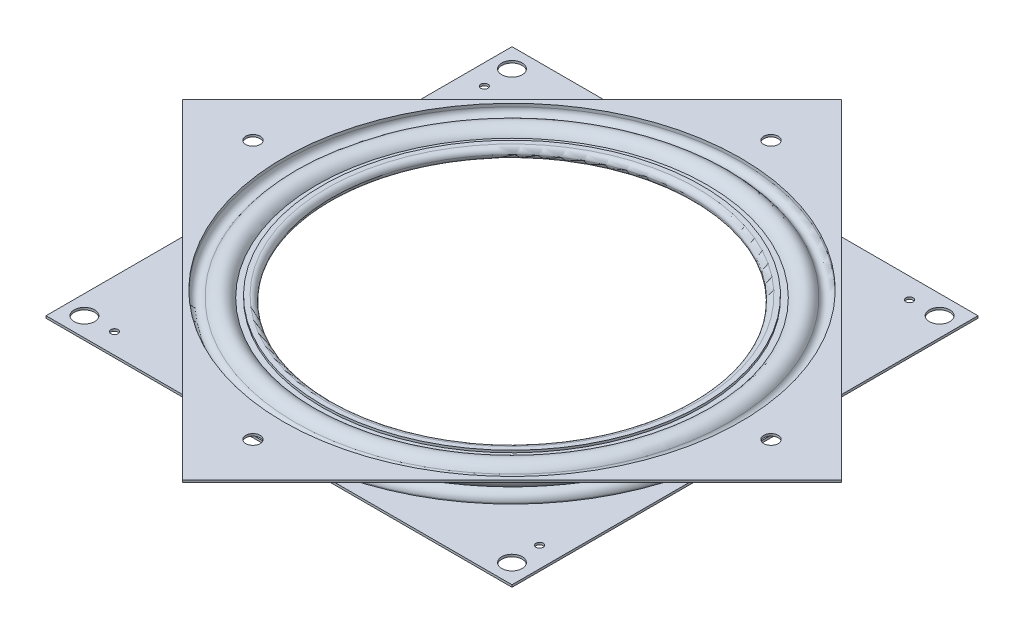
from build123d import *

# Parameters (mm, degrees)
SKETCH2_W                                 = 154.0002
SKETCH2_H                                 = 154.0002
SKETCH2_R                                 = 75.529340861
EXTRUDE1_DEPTH                            = 0.7366
EXTRUDE2_START                            = -0.7366
SKETCH3_R                                 = 75.529340861
EXTRUDE2_DEPTH                            = 0.7366
CIRPATTERN1_COUNT                         = 6
SKETCH5_W                                 = 3.3782
SKETCH5_H                                 = 0.7366
F_5_32_0_156250_DIAMETER_HOLE1_AT_2_COUNT = 2
F_5_32_0_156250_DIAMETER_HOLE1_AT_2_PITCH = 141.3002
F_5_32_0_156250_DIAMETER_HOLE1_AT_3_COUNT = 2
F_5_32_0_156250_DIAMETER_HOLE1_AT_3_PITCH = 141.3002
F_5_32_0_156250_DIAMETER_HOLE1_AT_4_COUNT = 2
F_5_32_0_156250_DIAMETER_HOLE1_AT_4_PITCH = 199.828659206
SKETCH7_W                                 = 2.3876
SKETCH7_H                                 = 8.128
F_5_32_0_156250_DIAMETER_HOLE2_AT_2_COUNT = 2
F_5_32_0_156250_DIAMETER_HOLE2_AT_2_PITCH = 121.0564
F_5_32_0_156250_DIAMETER_HOLE2_AT_3_COUNT = 2
F_5_32_0_156250_DIAMETER_HOLE2_AT_3_PITCH = 171.199602692
F_5_32_0_156250_DIAMETER_HOLE2_AT_4_COUNT = 2
F_5_32_0_156250_DIAMETER_HOLE2_AT_4_PITCH = 121.0564
CIRPATTERN2_COUNT                         = 4


# Read off the part's stored shape, not the designer's step: Revolve-Thin5
with BuildPart() as part:
    # Sketch1 → Revolve-Thin4 (revolve)
    with BuildSketch(Plane.XY, mode=Mode.PRIVATE) as revolve_thin4_sk:
        with BuildLine():
            Line((62.74854946, 1.778), (61.214, 1.778))
            ThreePointArc((61.214, 1.778), (59.436, 0), (61.214, -1.778))
            Line((61.214, -1.778), (64.28309892, -1.778))
            ThreePointArc((64.28309892, -1.778), (67.669225582, -4.788771381), (71.737577241, -2.794))
            ThreePointArc((71.737577241, -2.794), (74.023261161, -1.847238721), (75.529340861, -3.81))
            Line((75.529340861, -3.81), (75.529340861, -4.826))
            Line((75.529340861, -4.826), (77.0001, -4.826))
            Line((77.0001, -4.826), (77.0001, -4.0894))
            Line((77.0001, -4.0894), (76.265940861, -4.0894))
            Line((76.265940861, -4.0894), (76.265940861, -3.81))
            ThreePointArc((76.265940861, -3.81), (74.21390727, -1.135737757), (71.099662929, -2.4257))
            ThreePointArc((71.099662929, -2.4257), (67.492675346, -4.00937161), (64.902401285, -1.0414))
            Line((64.902401285, -1.0414), (61.214, -1.0414))
            ThreePointArc((61.214, -1.0414), (60.1726, 0), (61.214, 1.0414))
            Line((61.214, 1.0414), (62.74854946, 1.0414))
            Line((62.74854946, 1.0414), (62.74854946, 1.778))
        make_face()
    revolve(revolve_thin4_sk.sketch.rotate(Axis((0, 21.71272626, 0), (0, -1, 0)), 90), axis=Axis((0, 21.71272626, 0), (0, -1, 0)))

    # Sketch2 → Extrude1 (add)
    with BuildSketch(Plane.XZ.offset(4.826)):
        Rectangle(SKETCH2_W, SKETCH2_H)
        with Locations(Location((0, 0, 0), (0, 0, 90))):
            Circle(SKETCH2_R, mode=Mode.SUBTRACT)
    extrude(amount=-EXTRUDE1_DEPTH)

    # Sketch5 → 5/32 (0.156250) Diameter Hole1 (revolve, cut)
    with BuildSketch(Plane(origin=(70.6501, -4.0894, -70.6501), x_dir=(0, 0, 1), z_dir=(1, 0, 0))):
        with Locations((1.6891, 0.3683)):
            Rectangle(SKETCH5_W, SKETCH5_H)
    f_5_32_0_156250_diameter_hole1 = revolve(axis=Axis((70.6501, 2.2606, -70.6501), (0, -1, 0)), mode=Mode.SUBTRACT)

    # 5/32 (0.156250) Diameter Hole1 at 2: 5/32 (0.156250) Diameter Hole1 ×2
    with Locations(*[(0, 0, i * F_5_32_0_156250_DIAMETER_HOLE1_AT_2_PITCH) for i in range(1, F_5_32_0_156250_DIAMETER_HOLE1_AT_2_COUNT)]):
        add(f_5_32_0_156250_diameter_hole1, mode=Mode.SUBTRACT)

    # 5/32 (0.156250) Diameter Hole1 at 3: 5/32 (0.156250) Diameter Hole1 ×2
    with Locations(*[(-i * F_5_32_0_156250_DIAMETER_HOLE1_AT_3_PITCH, 0, 0) for i in range(1, F_5_32_0_156250_DIAMETER_HOLE1_AT_3_COUNT)]):
        add(f_5_32_0_156250_diameter_hole1, mode=Mode.SUBTRACT)

    # 5/32 (0.156250) Diameter Hole1 at 4: 5/32 (0.156250) Diameter Hole1 ×2
    with Locations(*[Vector(-0.7071067811865476, 0, 0.7071067811865476) * (i * F_5_32_0_156250_DIAMETER_HOLE1_AT_4_PITCH) for i in range(1, F_5_32_0_156250_DIAMETER_HOLE1_AT_4_COUNT)]):
        add(f_5_32_0_156250_diameter_hole1, mode=Mode.SUBTRACT)

    # Sketch11 → 3/32 (0.093750) Diameter Hole2 (revolve, cut)
    with BuildSketch(Plane(origin=(-70.2437, -4.0894, -61.1251), x_dir=(0, 0, 1), z_dir=(1, 0, 0))):
        Polygon((0, 0), (0, 26.115399675), (1.190625, 25.4), (1.190625, 0), align=None)
    f_3_32_0_093750_diameter_hole2 = revolve(axis=Axis((-70.2437, 2.2606, -61.1251), (0, -1, 0)), mode=Mode.SUBTRACT)

    # CirPattern2: 3/32 (0.093750) Diameter Hole2 ×4 about axis
    cirpattern2_axis = Axis((0, 0, 0), (0, 1, 0))
    for i in range(1, CIRPATTERN2_COUNT):
        add(f_3_32_0_093750_diameter_hole2.rotate(cirpattern2_axis, i * 360 / CIRPATTERN2_COUNT), mode=Mode.SUBTRACT)


with BuildPart() as body_2:
    # Revolve-Thin5 outline → Revolve-Thin5 (revolve)
    with BuildSketch(Plane.XY):
        with BuildLine():
            Line((77.0001, 3.302), (75.529340861, 3.302))
            Line((75.529340861, 3.302), (75.529340861, 2.286))
            ThreePointArc((75.529340861, 2.286), (74.023261161, 0.323238721), (71.737577241, 1.27))
            ThreePointArc((71.737577241, 1.27), (68.088390068, 3.299931105), (64.576093872, 1.0414))
            Line((64.576093872, 1.0414), (61.214, 1.0414))
            Line((61.214, 1.0414), (61.214, 0.3048))
            Line((61.214, 0.3048), (65.066299927, 0.3048))
            ThreePointArc((65.066299927, 0.3048), (67.890458911, 2.54923464), (71.099662929, 0.9017))
            ThreePointArc((71.099662929, 0.9017), (74.21390727, -0.388262243), (76.265940861, 2.286))
            Line((76.265940861, 2.286), (76.265940861, 2.5654))
            Line((76.265940861, 2.5654), (77.0001, 2.5654))
            Line((77.0001, 2.5654), (77.0001, 3.302))
        make_face()
    revolve(axis=Axis((0, 0, 0), (0, 1, 0)))

    # Sketch3 → Extrude2 (add)
    with BuildSketch(Plane(origin=(0, 3.302, 0), x_dir=(-1, 0, 0), z_dir=(0, 1, 0)).offset(EXTRUDE2_START)):
        Polygon((0, -108.894585724), (108.894585724, 0), (0, 108.894585724), (-108.894585724, 0), align=None)
        with Locations(Location((0, 0, 0), (0, 0, 90))):
            Circle(SKETCH3_R, mode=Mode.SUBTRACT)
    extrude(amount=EXTRUDE2_DEPTH)

    # Sketch7 → 5/32 (0.156250) Diameter Hole2 (revolve, cut)
    with BuildSketch(Plane(origin=(85.599801346, 3.302, 0), x_dir=(0, 0, 1), z_dir=(1, 0, 0))):
        with Locations((1.1938, 4.064)):
            Rectangle(SKETCH7_W, SKETCH7_H)
    f_5_32_0_156250_diameter_hole2 = revolve(axis=Axis((85.599801346, 9.652, 0), (0, -1, 0)), mode=Mode.SUBTRACT)

    # 5/32 (0.156250) Diameter Hole2 at 2: 5/32 (0.156250) Diameter Hole2 ×2
    with Locations(*[Vector(-0.7071067811865476, 0, -0.7071067811865476) * (i * F_5_32_0_156250_DIAMETER_HOLE2_AT_2_PITCH) for i in range(1, F_5_32_0_156250_DIAMETER_HOLE2_AT_2_COUNT)]):
        add(f_5_32_0_156250_diameter_hole2, mode=Mode.SUBTRACT)

    # 5/32 (0.156250) Diameter Hole2 at 3: 5/32 (0.156250) Diameter Hole2 ×2
    with Locations(*[(-i * F_5_32_0_156250_DIAMETER_HOLE2_AT_3_PITCH, 0, 0) for i in range(1, F_5_32_0_156250_DIAMETER_HOLE2_AT_3_COUNT)]):
        add(f_5_32_0_156250_diameter_hole2, mode=Mode.SUBTRACT)

    # 5/32 (0.156250) Diameter Hole2 at 4: 5/32 (0.156250) Diameter Hole2 ×2
    with Locations(*[Vector(-0.7071067811865476, 0, 0.7071067811865476) * (i * F_5_32_0_156250_DIAMETER_HOLE2_AT_4_PITCH) for i in range(1, F_5_32_0_156250_DIAMETER_HOLE2_AT_4_COUNT)]):
        add(f_5_32_0_156250_diameter_hole2, mode=Mode.SUBTRACT)


with BuildPart() as body_3:
    # Sketch4 → Revolve1 (revolve)
    with BuildSketch(Plane.XY):
        with BuildLine():
            Line((68.21805, 2.5146), (68.21805, -4.0386))
            ThreePointArc((68.21805, -4.0386), (71.49465, -0.762), (68.21805, 2.5146))
        make_face()
    revolve(axis=Axis((68.21805, 2.837450101, 0), (0, -1, 0)))


with BuildPart() as cirpattern1_1:
    # CirPattern1: pattern copy
    add(body_3.part.rotate(Axis((0, 0, 0), (0, 1, 0)), 1 * 360 / CIRPATTERN1_COUNT))


with BuildPart() as cirpattern1_2:
    # CirPattern1: pattern copy
    add(body_3.part.rotate(Axis((0, 0, 0), (0, 1, 0)), 2 * 360 / CIRPATTERN1_COUNT))


with BuildPart() as cirpattern1_3:
    # CirPattern1: pattern copy
    add(body_3.part.rotate(Axis((0, 0, 0), (0, 1, 0)), 3 * 360 / CIRPATTERN1_COUNT))


with BuildPart() as cirpattern1_4:
    # CirPattern1: pattern copy
    add(body_3.part.rotate(Axis((0, 0, 0), (0, 1, 0)), 4 * 360 / CIRPATTERN1_COUNT))


with BuildPart() as cirpattern1_5:
    # CirPattern1: pattern copy
    add(body_3.part.rotate(Axis((0, 0, 0), (0, 1, 0)), 5 * 360 / CIRPATTERN1_COUNT))


solid = Compound([part.part, body_2.part, body_3.part, cirpattern1_1.part, cirpattern1_2.part, cirpattern1_3.part, cirpattern1_4.part, cirpattern1_5.part])
